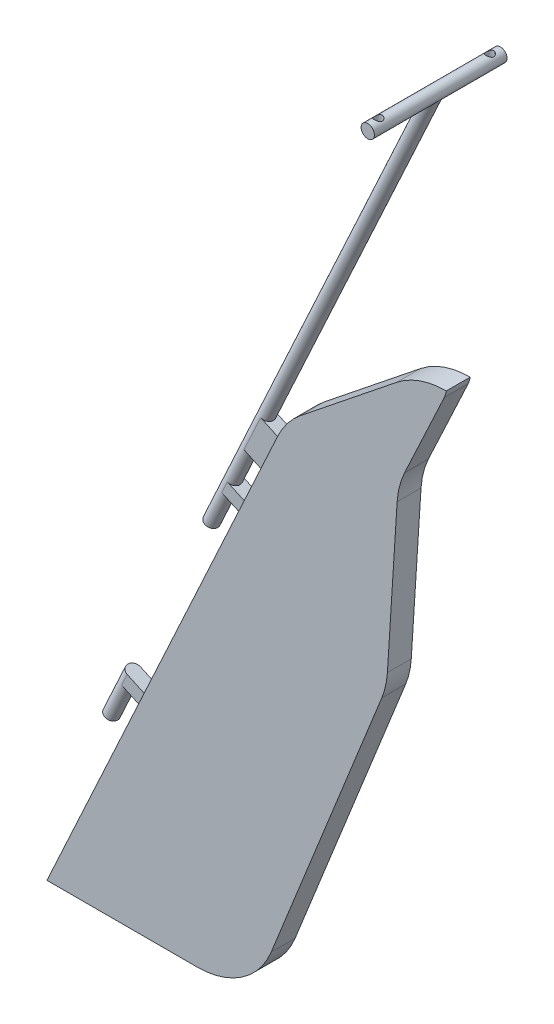
from build123d import *

# Parameters (mm, degrees)
BOSS_EXTRU_1_DEPTH           = 9
ESQUISSE36_W                 = 5
ESQUISSE36_H                 = 5
ESQUISSE36_H_2               = 15
BOSS_EXTRU_4_DEPTH           = 8
BALAYAGE2_PROFILE_R          = 2.5
BALAYAGE3_PROFILE_R          = 2.5
CONG_2_R                     = 30
CONG_3_R                     = 10
BALAYAGE4_PROFILE_R          = 2.5
ENL_V_MAT_EXTRU_2_DEPTH      = 363.063201398
ENL_V_MAT_EXTRU_2_DEPTH_BACK = 10
ESQUISSE103_R                = 1.5


with BuildPart() as part:
    # Esquisse1 → Boss.-Extru.1 (new body)
    with BuildSketch(Plane.XY):
        Polygon((0, 0), (90, 195), (140, 235), (150.932632942, 235), (132.339381175, 195.201149163), (127.997155304, 127.139031538), (76.950468366, 0), align=None)
    extrude(amount=BOSS_EXTRU_1_DEPTH)

    # Esquisse36 → Boss.-Extru.4 (add)
    with BuildSketch(Plane(origin=(0, 0, 0), x_dir=(0, 0, 1), z_dir=(-0.9079593845004518, 0.4190581774617469, 0))):
        with Locations((4.5, 172.267315949)):
            Rectangle(ESQUISSE36_W, ESQUISSE36_H)
        with Locations((4.5, 82.267315949)):
            Rectangle(ESQUISSE36_W, ESQUISSE36_H)
        with Locations((4.5, 197.267315949)):
            Rectangle(ESQUISSE36_W, ESQUISSE36_H_2)
    extrude(amount=BOSS_EXTRU_4_DEPTH)

    # Balayage2: sweep along a path in Esquisse37
    with BuildLine(Plane(origin=(-7.263675076, 3.35246542, 0), x_dir=(0, 0, 1), z_dir=(-0.9079593845004523, 0.4190581774617459, 0))) as balayage2_path:
        Line((4.5, 354.767315949), (4.5, 154.767315949))
    # Balayage2 profile (on start of the path) → Balayage2 (sweep)
    with BuildSketch(Plane(origin=(141.404469769, 325.46677925, 4.5), x_dir=(-0.9079593845004521, 0.41905817746174584, 0), z_dir=(-0.4190581774617459, -0.9079593845004523, 0))):
        Circle(BALAYAGE2_PROFILE_R)
    sweep(path=balayage2_path.line)

    # Balayage3: sweep along a path in Esquisse50
    with BuildLine(Plane(origin=(-7.263675076, 3.35246542, 0), x_dir=(0, 0, 1), z_dir=(-0.9079593845004512, 0.41905817746174806, 0))) as balayage3_path:
        Line((4.5, 84.767315949), (4.5, 64.767315949))
    # Balayage3 profile (on start of the path) → Balayage3 (sweep)
    with BuildSketch(Plane(origin=(28.258761854, 80.317745435, 4.5), x_dir=(-0.9079593845004512, 0.41905817746174806, 0), z_dir=(-0.41905817746174806, -0.9079593845004512, 0))):
        Circle(BALAYAGE3_PROFILE_R)
    sweep(path=balayage3_path.line)

    # Congé2
    cong_2_edges = [part.edges().sort_by_distance(p)[0] for p in [
        (90, 195, 4.5),
        (140, 235, 4.5),
        (132.339381175, 195.201149163, 4.5),
        (127.997155304, 127.139031538, 4.5),
        (76.950468366, 0, 4.5),
    ]]
    fillet(cong_2_edges, radius=CONG_2_R)

    # Congé3
    # the kernel refuses this fillet: 10 mm, written as the material it takes off along each edge
    with BuildSketch(Plane(origin=(150.932632942, 235, -7.177129448), x_dir=(-1, 0, 0), z_dir=(0, 0, 1))) as cong_3_piece_1:
        with BuildLine():
            CenterArc((10.275185308, -1.631673015), CONG_3_R, 154.958930111, 15.650284086)
            Line((1.215139114, 2.601004974), (0, 0))
            Line((0, 0), (0.409201162, 0))
        make_face()
    extrude(amount=23.354258897, mode=Mode.SUBTRACT)

    # Balayage4: sweep along a path in Esquisse88
    with BuildLine(Plane(origin=(148.668144845, 322.11431383, 0), x_dir=(0.907959384500452, -0.4190581774617463, 0), z_dir=(0.41905817746174623, 0.9079593845004519, 0))) as balayage4_path:
        Line((-8, 20.5), (-8, -29.5))
    # Balayage4 profile (on start of the path) → Balayage4 (sweep)
    with BuildSketch(Plane(origin=(141.404469769, 325.46677925, -20.5), x_dir=(0, 1, 0), z_dir=(0, 0, 1))):
        Circle(BALAYAGE4_PROFILE_R)
    sweep(path=balayage4_path.line)

    # Esquisse103 → Enlèv. mat.-Extru.2 (cut, two sides: drawn at the far end of the back side and taken through both)
    with BuildSketch(Plane(origin=(0, 0, 0), x_dir=(1, 0, 0), z_dir=(0, 1, 0)).offset(-ENL_V_MAT_EXTRU_2_DEPTH_BACK)):
        with Locations(Location((141.404469769, 16.5, 0), (0, 0, 90))):
            Circle(ESQUISSE103_R)
        with Locations(Location((141.391933609, -25.5, 0), (0, 0, 90))):
            Circle(ESQUISSE103_R)
    extrude(amount=ENL_V_MAT_EXTRU_2_DEPTH + ENL_V_MAT_EXTRU_2_DEPTH_BACK, mode=Mode.SUBTRACT)


solid = part.part
